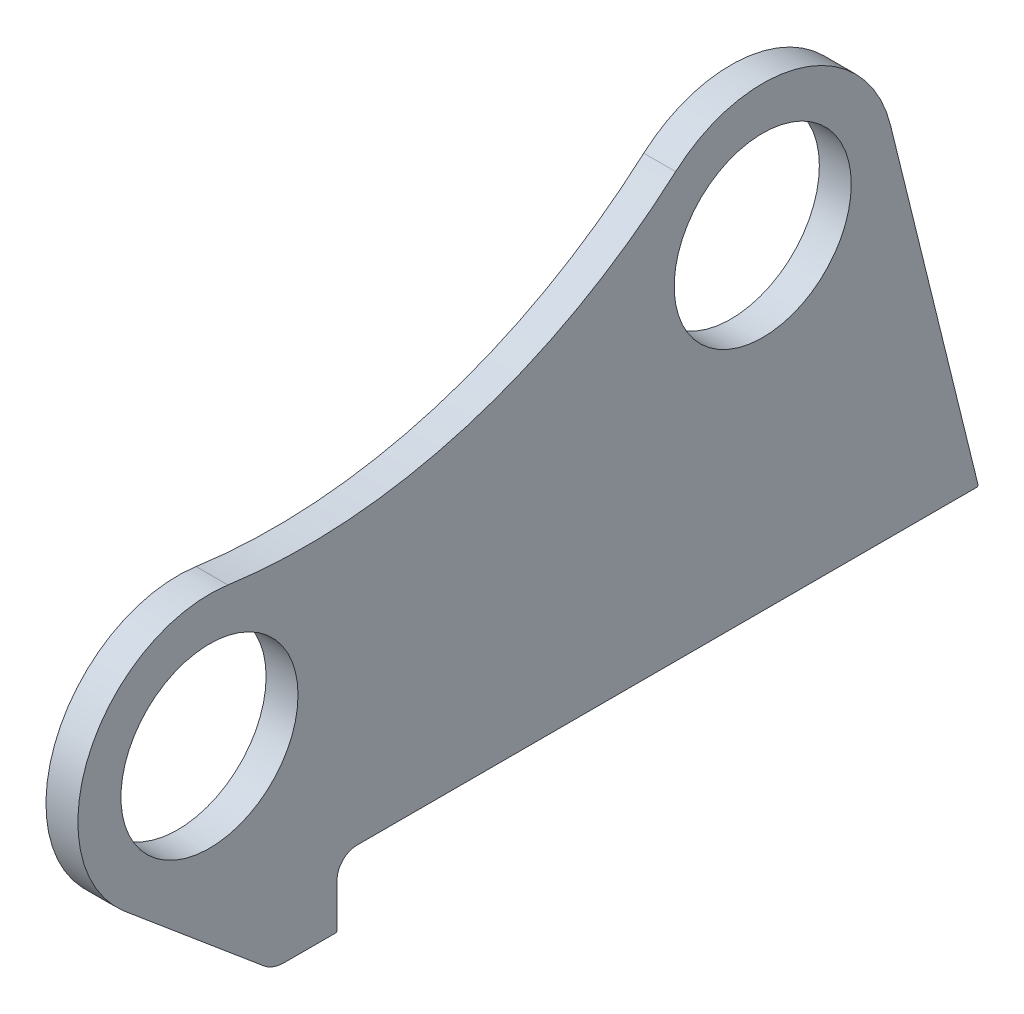
from build123d import *

# Parameters (mm, degrees)
SKETCH1_R          = 55.5
BASE_FLANGE1_DEPTH = 20
FILLET_1_0_R       = 1


# Sheet-metal steps are written as plain solids
with BuildPart() as part:
    # Sketch1 → Base-Flange1 (new body)
    with BuildSketch(Plane(origin=(0, 0, 0), x_dir=(0, 0, -1), z_dir=(1, 0, 0))):
        with BuildLine():
            Line((0, -41), (0, -12.5))
            ThreePointArc((0, -12.5), (3.661165235, -3.661165235), (12.5, 0))
            Line((12.5, 0), (402, 0))
            Line((402, 0), (346.87955959, 223.617766639))
            ThreePointArc((346.87955959, 223.617766639), (291.405611492, 282.611111197), (212.20304892, 265.743162247))
            ThreePointArc((212.20304892, 265.743162247), (81.106216912, 192.940833045), (-68.425866876, 181.684083165))
            ThreePointArc((-68.425866876, 181.684083165), (-155.341011221, 133.615205312), (-133.058215758, 36.825038658))
            Line((-133.058215758, 36.825038658), (-45.972209781, -36.315142143))
            ThreePointArc((-45.972209781, -36.315142143), (-39.95421417, -39.792323471), (-33.109612021, -41))
            Line((-33.109612021, -41), (0, -41))
        make_face()
        with Locations((-80, 100)):
            Circle(SKETCH1_R, mode=Mode.SUBTRACT)
        with Locations((266.777160234, 203.873004866)):
            Circle(SKETCH1_R, mode=Mode.SUBTRACT)
    extrude(amount=-BASE_FLANGE1_DEPTH)

    # Fillet-1.0
    fillet_1_0_edges = [part.edges().sort_by_distance(p)[0] for p in [
        (-10, 0, -402),
        (-10, -41, 0),
    ]]
    fillet(fillet_1_0_edges, radius=FILLET_1_0_R)


solid = part.part
